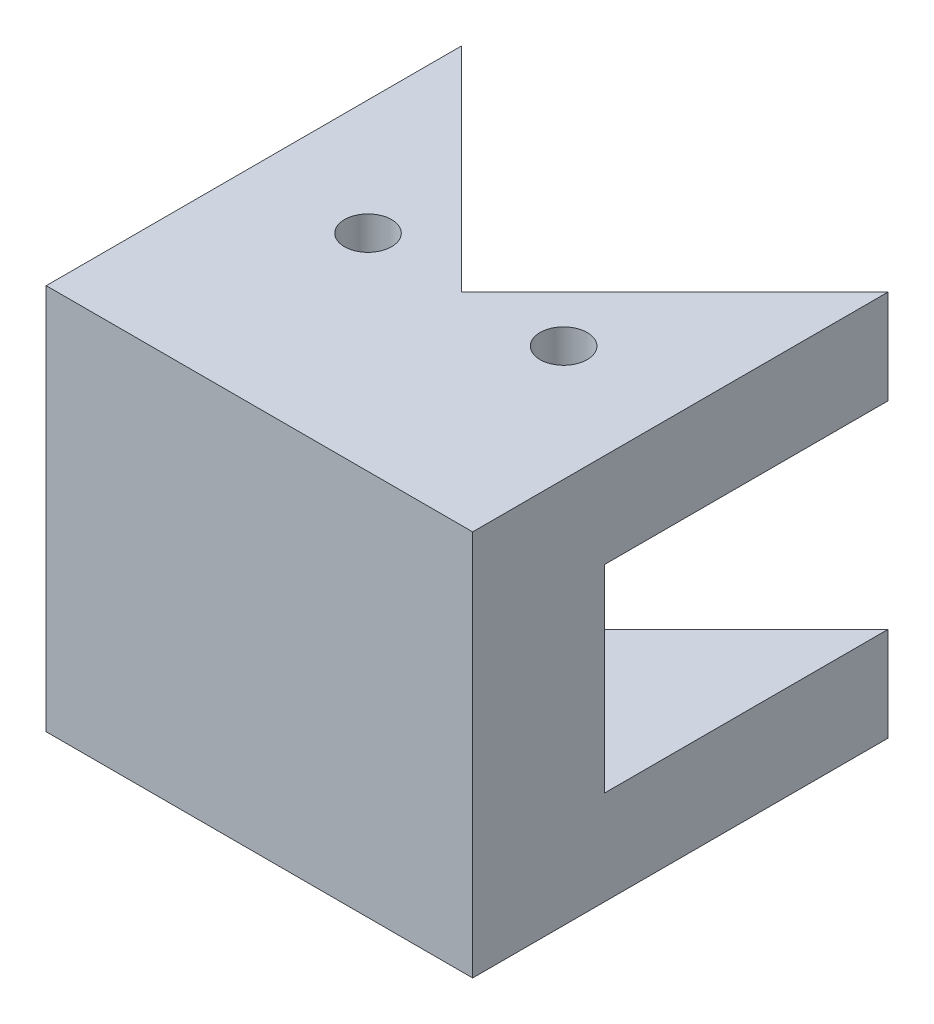
from build123d import *

# Parameters (mm, degrees)
SKETCH1_W           = 45.25
SKETCH1_H           = 21
BOSS_EXTRUDE1_DEPTH = 8
BOSS_EXTRUDE3_DEPTH = 10
BOSS_EXTRUDE4_DEPTH = 10
SKETCH5_W           = 45.25
SKETCH5_H           = 8
BOSS_EXTRUDE5_DEPTH = 10
SKETCH6_W           = 45.25
SKETCH6_H           = 8
BOSS_EXTRUDE6_DEPTH = 10
SKETCH7_W           = 33.369667902
SKETCH7_H           = 21
CUT_EXTRUDE1_DEPTH  = 5
SKETCH8_W           = 45.25
SKETCH8_H           = 41
BOSS_EXTRUDE7_DEPTH = 6
HOLE1_START         = -10
HOLE1_OUTLINE_R     = 2.5
HOLE1_DEPTH         = 41
HOLE2_START         = -10
HOLE2_OUTLINE_R     = 2.5
HOLE2_DEPTH         = 41


# Read off the part's stored shape, not the designer's step: Hole1, Hole2
with BuildPart() as part:
    # Sketch1 → Boss-Extrude1 (new body)
    with BuildSketch(Plane.XY):
        with Locations((22.625, 10.5)):
            Rectangle(SKETCH1_W, SKETCH1_H)
    extrude(amount=BOSS_EXTRUDE1_DEPTH)



with BuildPart() as body_2:
    # Sketch3 → Boss-Extrude3 (new body)
    with BuildSketch(Plane(origin=(0, 21, 0), x_dir=(1, 0, 0), z_dir=(0, 1, 0))):
        Polygon((45.25, 0), (0, 0), (0, 30.05), (22.625, 7.420166262), (45.25, 30.05), align=None)
    extrude(amount=BOSS_EXTRUDE3_DEPTH)


with BuildPart() as body_3:
    # Sketch4 → Boss-Extrude4 (new body)
    with BuildSketch(Plane.XZ):
        Polygon((0, 0), (45.25, 0), (45.25, -30.05), (22.625, -7.420166262), (0, -30.05), align=None)
    extrude(amount=BOSS_EXTRUDE4_DEPTH)


with BuildPart() as part_1:
    add(part.part)

    add(body_2.part)  # Boss-Extrude5 merges body 2
    # Sketch5 → Boss-Extrude5 (add)
    with BuildSketch(Plane(origin=(0, 21, 0), x_dir=(1, 0, 0), z_dir=(0, 1, 0))):
        with Locations((22.625, -4)):
            Rectangle(SKETCH5_W, SKETCH5_H)
    extrude(amount=BOSS_EXTRUDE5_DEPTH)


    add(body_3.part)  # Boss-Extrude6 merges body 3
    # Sketch6 → Boss-Extrude6 (add)
    with BuildSketch(Plane.XZ):
        with Locations((22.625, 4)):
            Rectangle(SKETCH6_W, SKETCH6_H)
    extrude(amount=BOSS_EXTRUDE6_DEPTH)

    # Sketch7 → Cut-Extrude1 (cut)
    with BuildSketch(Plane(origin=(0, 0, 0), x_dir=(-1, 0, 0), z_dir=(0, 0, -1))):
        with Locations((-22.625, 10.5)):
            Rectangle(SKETCH7_W, SKETCH7_H)
    extrude(amount=-CUT_EXTRUDE1_DEPTH, mode=Mode.SUBTRACT)

    # Sketch8 → Boss-Extrude7 (add)
    with BuildSketch(Plane.XY.offset(8)):
        with Locations((22.625, 10.5)):
            Rectangle(SKETCH8_W, SKETCH8_H)
    extrude(amount=BOSS_EXTRUDE7_DEPTH)

    # Hole1 outline → Hole1 (cut)
    with BuildSketch(Plane(origin=(0, 0, 0), x_dir=(1, 0, 0), z_dir=(0, 1, 0)).offset(HOLE1_START)):
        with Locations((33.003168971, 7.9)):
            Circle(HOLE1_OUTLINE_R)
    extrude(amount=HOLE1_DEPTH, mode=Mode.SUBTRACT)

    # Hole2 outline → Hole2 (cut)
    with BuildSketch(Plane(origin=(0, 0, 0), x_dir=(1, 0, 0), z_dir=(0, 1, 0)).offset(HOLE2_START)):
        with Locations((12.246831029, 7.9)):
            Circle(HOLE2_OUTLINE_R)
    extrude(amount=HOLE2_DEPTH, mode=Mode.SUBTRACT)


solid = part_1.part
